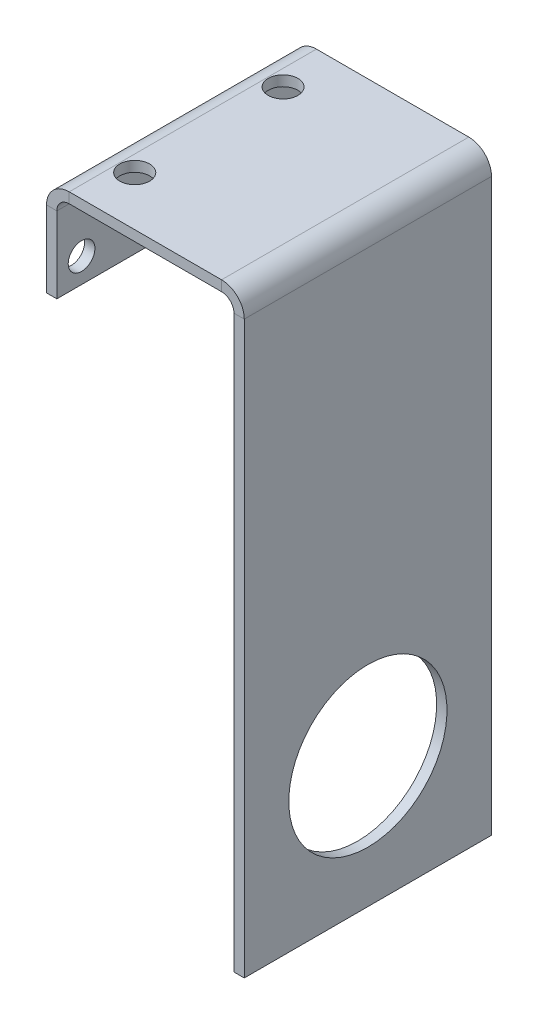
from build123d import *

# Parameters (mm, degrees)
BASE_FLANGE1_DEPTH = 63.5
SKETCH6_R          = 3.429
CUT_EXTRUDE1_DEPTH = 6.35
SKETCH7_R          = 20.32
CUT_EXTRUDE2_DEPTH = 6.35
SKETCH8_R          = 3.81
SKETCH8_R_2        = 3.831524444
CUT_EXTRUDE3_DEPTH = 6.35


# Read off the part's stored shape, not the designer's step: Base-Flange1
with BuildPart() as part:
    # Base-Flange1 outline → Base-Flange1 (new body)
    with BuildSketch(Plane.XY):
        with BuildLine():
            Line((48.14316, 19.56816), (48.14316, -127))
            Line((48.14316, -127), (50.8, -127))
            Line((50.8, -127), (50.8, 19.56816))
            ThreePointArc((50.8, 19.56816), (49.091893611, 23.691893611), (44.96816, 25.4))
            Line((44.96816, 25.4), (5.83184, 25.4))
            ThreePointArc((5.83184, 25.4), (1.708106389, 23.691893611), (0, 19.56816))
            Line((0, 19.56816), (0, 0))
            Line((0, 0), (2.65684, 0))
            Line((2.65684, 0), (2.65684, 19.56816))
            ThreePointArc((2.65684, 19.56816), (3.58677597, 21.81322403), (5.83184, 22.74316))
            Line((5.83184, 22.74316), (44.96816, 22.74316))
            ThreePointArc((44.96816, 22.74316), (47.21322403, 21.81322403), (48.14316, 19.56816))
        make_face()
    extrude(amount=BASE_FLANGE1_DEPTH)

    # Sketch6 → Cut-Extrude1 (cut)
    with BuildSketch(Plane.ZY):
        with Locations((6.35, 6.35)):
            Circle(SKETCH6_R)
        with Locations((57.15, 6.35)):
            Circle(SKETCH6_R)
    extrude(amount=-CUT_EXTRUDE1_DEPTH, mode=Mode.SUBTRACT)

    # Sketch7 → Cut-Extrude2 (cut)
    with BuildSketch(Plane(origin=(50.8, 0, 0), x_dir=(0, 0, -1), z_dir=(1, 0, 0))):
        with Locations(Location((-31.75, -93.46184, 0), (0, 0, 90))):
            Circle(SKETCH7_R)
    extrude(amount=-CUT_EXTRUDE2_DEPTH, mode=Mode.SUBTRACT)

    # Sketch8 → Cut-Extrude3 (cut)
    with BuildSketch(Plane(origin=(0, 25.4, 0), x_dir=(1, 0, 0), z_dir=(0, 1, 0))):
        with Locations(Location((9.9568, -12.699999998, 0), (0, 0, 270))):
            Circle(SKETCH8_R)
        with Locations(Location((9.9568, -50.799999998, 0), (0, 0, 270))):
            Circle(SKETCH8_R_2)
    extrude(amount=-CUT_EXTRUDE3_DEPTH, mode=Mode.SUBTRACT)


solid = part.part
